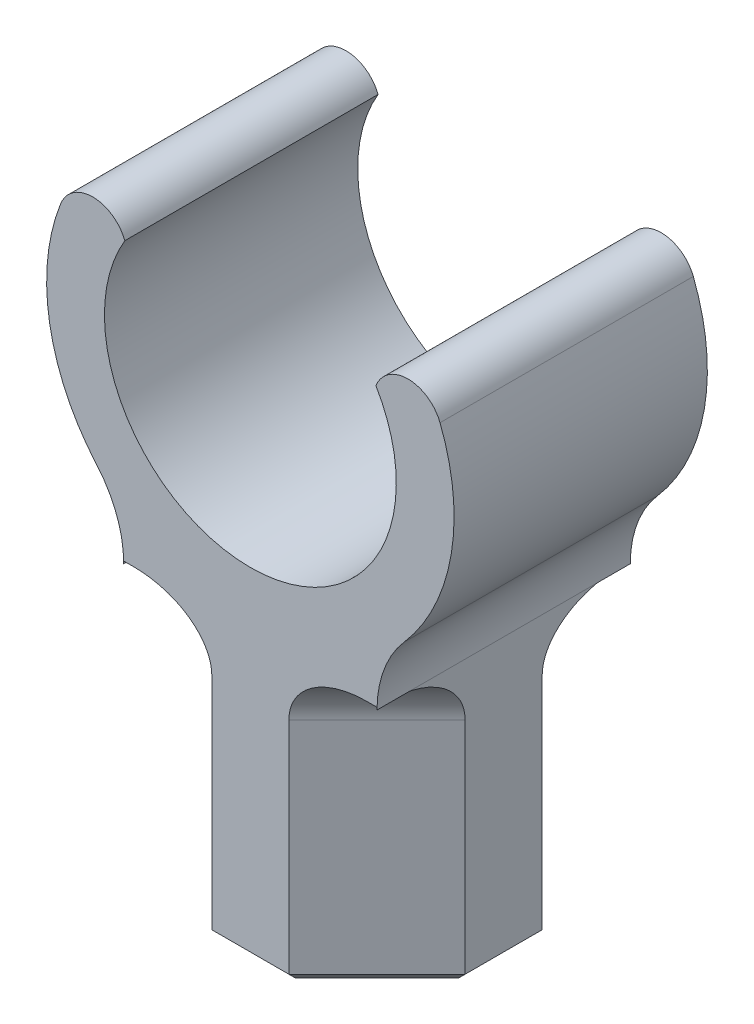
from build123d import *

# Parameters (mm, degrees)
BOSS_EXTRUDE1_DEPTH = 23
FILLET1_R           = 10
SKETCH2_W           = 13
SKETCH2_H           = 13
CUT_EXTRUDE1_DEPTH  = 20
CHAMFER2_SIZE       = 3.5
CUT_EXTRUDE2_DEPTH  = 26
CHAMFER3_SIZE       = 1
FILLET2_R           = 5


with BuildPart() as part:
    # Sketch1 → Boss-Extrude1 (new body)
    with BuildSketch(Plane.XY):
        with BuildLine():
            Line((-11.5, -14.491376746), (-11.5, -44.491376746))
            Line((-11.5, -44.491376746), (11.5, -44.491376746))
            Line((11.5, -44.491376746), (11.5, -14.491376746))
            ThreePointArc((11.5, -14.491376746), (17.862669336, -4.814046549), (17.224619009, 6.75))
            ThreePointArc((17.224619009, 6.75), (14.31318663, 8.736071822), (11.401754251, 6.75))
            ThreePointArc((11.401754251, 6.75), (0, -13.25), (-11.401754251, 6.75))
            ThreePointArc((-11.401754251, 6.75), (-14.31318663, 8.736071822), (-17.224619009, 6.75))
            ThreePointArc((-17.224619009, 6.75), (-17.862669336, -4.814046549), (-11.5, -14.491376746))
        make_face()
    extrude(amount=BOSS_EXTRUDE1_DEPTH)

    # Fillet1
    fillet1_edges = [part.edges().sort_by_distance(p)[0] for p in [
        (-11.5, -14.491376746, 11.5),
        (11.5, -14.491376746, 11.5),
    ]]
    fillet(fillet1_edges, radius=FILLET1_R)

    # Sketch2 → Cut-Extrude1 (cut)
    with BuildSketch(Plane.XZ.offset(44.491376746)):
        with Locations((0, 11.5)):
            Rectangle(SKETCH2_W, SKETCH2_H)
    extrude(amount=-CUT_EXTRUDE1_DEPTH, mode=Mode.SUBTRACT)

    # Chamfer2
    chamfer2_edges = [part.edges().sort_by_distance(p)[0] for p in [
        (-6.5, -34.491376746, 5),
        (-6.5, -34.491376746, 18),
        (6.5, -34.491376746, 18),
        (6.5, -34.491376746, 5),
    ]]
    chamfer(chamfer2_edges, length=CHAMFER2_SIZE)

    # Sketch3 → Cut-Extrude2 (cut)
    with BuildSketch(Plane.XZ.offset(44.491376746)):
        Polygon((-11.5, 15), (-3.5, 23), (-11.5, 23), align=None)
        Polygon((3.5, 23), (11.5, 15), (11.5, 23), align=None)
        Polygon((11.5, 0), (11.5, 8), (3.5, 0), align=None)
        Polygon((-11.5, 0), (-3.5, 0), (-11.5, 8), align=None)
    extrude(amount=-CUT_EXTRUDE2_DEPTH, mode=Mode.SUBTRACT)

    # Chamfer3
    chamfer3_edges = [part.edges().sort_by_distance(p)[0] for p in [
        (7.5, -44.491376746, 4),
        (7.5, -44.491376746, 19),
        (-7.5, -44.491376746, 19),
        (0, -44.491376746, 5),
        (-6.5, -44.491376746, 11.5),
        (6.5, -44.491376746, 11.5),
        (0, -44.491376746, 18),
        (-4.75, -44.491376746, 6.75),
        (4.75, -44.491376746, 6.75),
        (4.75, -44.491376746, 16.25),
        (-4.75, -44.491376746, 16.25),
        (0, -44.491376746, 0),
        (0, -44.491376746, 23),
        (11.5, -44.491376746, 11.5),
        (-11.5, -44.491376746, 11.5),
        (-7.5, -44.491376746, 4),
    ]]
    chamfer(chamfer3_edges, length=CHAMFER3_SIZE)

    # Fillet2
    # the kernel refuses this fillet: 5 mm, written as the material it adds along each edge
    with BuildSketch(Plane(origin=(20.338834765, -18.491376746, 16.838834765), x_dir=(0, -1, 0), z_dir=(-0.7071067811865476, 0, -0.7071067811865476))) as fillet2_piece_1_section:
        with BuildLine():
            CenterArc((FILLET2_R, -FILLET2_R), FILLET2_R, 90, 90)
            Line((0, -FILLET2_R), (0, 0))
            Line((0, 0), (FILLET2_R, 0))
        make_face()
    fillet2_piece_1 = extrude(amount=36.313708499, mode=Mode.PRIVATE)
    fillet2_piece_1 = split(fillet2_piece_1, bisect_by=Plane(origin=(11.5, -19.775050917, 3.381146021), z_dir=(-1, 0, 0)), keep=Keep.TOP, mode=Mode.PRIVATE)
    fillet2_piece_1 = split(fillet2_piece_1, bisect_by=Plane(origin=(8.118853979, -19.775050917, 0), z_dir=(0, 0, 1)), keep=Keep.TOP, mode=Mode.PRIVATE)
    add(fillet2_piece_1)
    with BuildSketch(Plane(origin=(-5.338834765, -18.491376746, 31.838834765), x_dir=(0, -1, 0), z_dir=(0.7071067811865476, 0, -0.7071067811865476))) as fillet2_piece_2_section:
        with BuildLine():
            CenterArc((FILLET2_R, -FILLET2_R), FILLET2_R, 90, 90)
            Line((0, -FILLET2_R), (0, 0))
            Line((0, 0), (FILLET2_R, 0))
        make_face()
    fillet2_piece_2 = extrude(amount=36.313708499, mode=Mode.PRIVATE)
    fillet2_piece_2 = split(fillet2_piece_2, bisect_by=Plane(origin=(8.118853979, -19.775050917, 23), z_dir=(0, 0, -1)), keep=Keep.TOP, mode=Mode.PRIVATE)
    fillet2_piece_2 = split(fillet2_piece_2, bisect_by=Plane(origin=(11.5, -19.775050917, 19.618853979), z_dir=(-1, 0, 0)), keep=Keep.TOP, mode=Mode.PRIVATE)
    add(fillet2_piece_2)
    with BuildSketch(Plane(origin=(-20.338834765, -18.491376746, 6.161165235), x_dir=(0, -1, 0), z_dir=(0.7071067811865476, 0, 0.7071067811865476))) as fillet2_piece_3_section:
        with BuildLine():
            CenterArc((FILLET2_R, -FILLET2_R), FILLET2_R, 90, 90)
            Line((0, -FILLET2_R), (0, 0))
            Line((0, 0), (FILLET2_R, 0))
        make_face()
    fillet2_piece_3 = extrude(amount=36.313708499, mode=Mode.PRIVATE)
    fillet2_piece_3 = split(fillet2_piece_3, bisect_by=Plane(origin=(-8.118853979, -19.775050917, 23), z_dir=(0, 0, -1)), keep=Keep.TOP, mode=Mode.PRIVATE)
    fillet2_piece_3 = split(fillet2_piece_3, bisect_by=Plane(origin=(-11.5, -19.775050917, 19.618853979), z_dir=(1, 0, 0)), keep=Keep.TOP, mode=Mode.PRIVATE)
    add(fillet2_piece_3)
    with BuildSketch(Plane(origin=(5.338834765, -18.491376746, -8.838834765), x_dir=(0, -1, 0), z_dir=(-0.7071067811865476, 0, 0.7071067811865476))) as fillet2_piece_4_section:
        with BuildLine():
            CenterArc((FILLET2_R, -FILLET2_R), FILLET2_R, 90, 90)
            Line((0, -FILLET2_R), (0, 0))
            Line((0, 0), (FILLET2_R, 0))
        make_face()
    fillet2_piece_4 = extrude(amount=36.313708499, mode=Mode.PRIVATE)
    fillet2_piece_4 = split(fillet2_piece_4, bisect_by=Plane(origin=(-8.118853979, -19.775050917, 0), z_dir=(0, 0, 1)), keep=Keep.TOP, mode=Mode.PRIVATE)
    fillet2_piece_4 = split(fillet2_piece_4, bisect_by=Plane(origin=(-11.5, -19.775050917, 3.381146021), z_dir=(1, 0, 0)), keep=Keep.TOP, mode=Mode.PRIVATE)
    add(fillet2_piece_4)


solid = part.part
